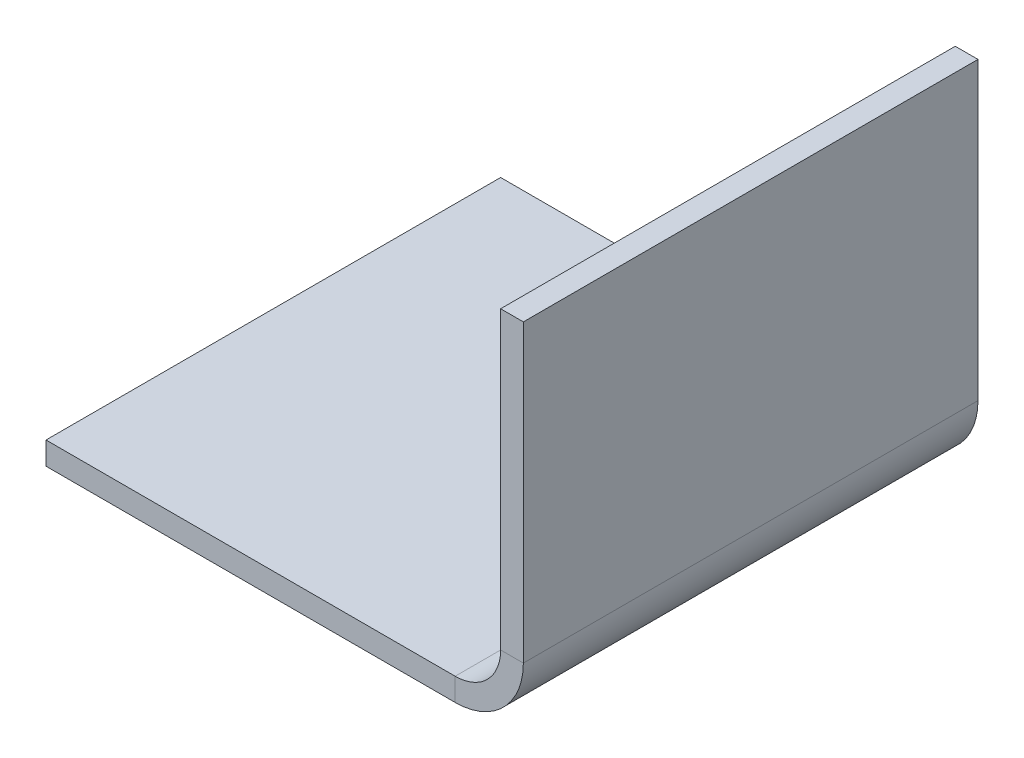
from build123d import *

# Parameters (mm, degrees)
SM_BASE_FLANGE_1_DEPTH = 20


# Sheet-metal steps are written as plain solids
with BuildPart() as part:
    # Sketch 1 → 基体-法兰1 (new body)
    with BuildSketch(Plane.XY):
        with BuildLine():
            Line((0, 0), (18, 0))
            ThreePointArc((18, 0), (19.414213562, 0.585786438), (20, 2))
            Line((20, 2), (20, 15))
            Line((20, 15), (21, 15))
            Line((21, 15), (21, 2))
            ThreePointArc((21, 2), (20.121320344, -0.121320344), (18, -1))
            Line((18, -1), (0, -1))
            Line((0, -1), (0, 0))
        make_face()
    extrude(amount=SM_BASE_FLANGE_1_DEPTH)


solid = part.part
